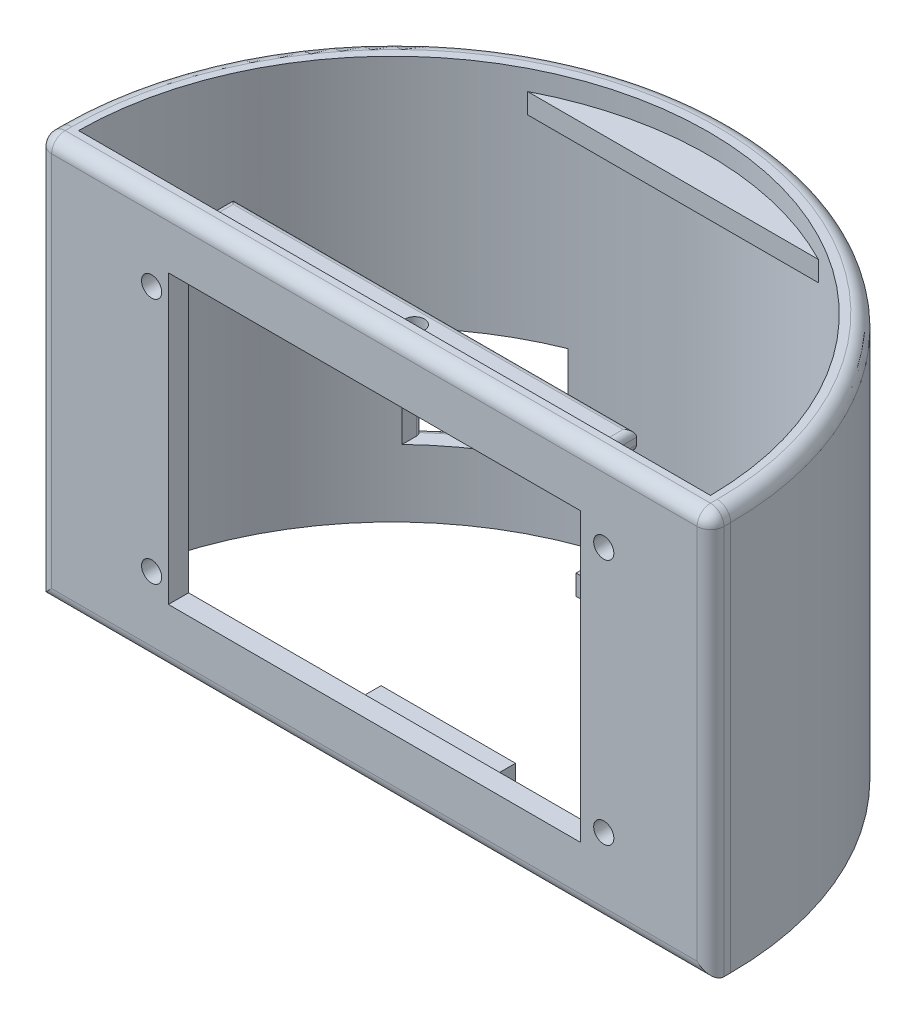
from build123d import *

# Parameters (mm, degrees)
SKETCH1_W                = 100
SKETCH1_H                = 60
SKETCH1_R                = 1.5
SKETCH1_W_2              = 61.26
SKETCH1_H_2              = 42.72
FRONT_FACE_DEPTH         = 3
CURVED_BCK_DEPTH         = 60
FILLET1_R                = 2
FRONT_START              = 57
SKETCH3_W                = 60
SKETCH3_H                = 6
SKETCH3_R                = 1.45
FRONT_RETAINER_DEPTH     = 3
FILLET2_R                = 1
FILLET3_R                = 1
BOSS_EXTRUDE4_START      = 54
BOSS_EXTRUDE4_DEPTH      = 3
CUT_EXTRUDE1_START       = -10
SKETCH5_W                = 15
SKETCH5_H                = 15
CUT_EXTRUDE1_DEPTH       = 53
SKETCH6_W                = 20
SKETCH6_H                = 3
BOSS_EXTRUDE5_DEPTH      = 8
SKETCH7_R                = 1.45
CUT_EXTRUDE2_DEPTH       = 3
FILLET4_R                = 2
FILLET5_R                = 1
BOSS_EXTRUDE6_DEPTH      = 10
BOSS_EXTRUDE6_DEPTH_BACK = 1
BOSS_EXTRUDE6_START      = 30
SKETCH9_W                = 20
SKETCH9_H                = 3
SKETCH10_R               = 1.45
CUT_EXTRUDE3_DEPTH       = 10


with BuildPart() as part:
    # Sketch1 → Front Face (new body)
    with BuildSketch(Plane.XY):
        with Locations((50, 30)):
            Rectangle(SKETCH1_W, SKETCH1_H)
        with Locations((84.12, 48.36)):
            Circle(SKETCH1_R, mode=Mode.SUBTRACT)
        with Locations((16.87, 48.36)):
            Circle(SKETCH1_R, mode=Mode.SUBTRACT)
        with Locations((16.87, 11.64)):
            Circle(SKETCH1_R, mode=Mode.SUBTRACT)
        with Locations((84.12, 11.64)):
            Circle(SKETCH1_R, mode=Mode.SUBTRACT)
        with Locations((50, 30)):
            Rectangle(SKETCH1_W_2, SKETCH1_H_2, mode=Mode.SUBTRACT)
    extrude(amount=FRONT_FACE_DEPTH)

    # Sketch2 → Curved bck (add)
    with BuildSketch(Plane(origin=(0, 0, 0), x_dir=(1, 0, 0), z_dir=(0, 1, 0))):
        with BuildLine():
            Line((0, 0), (3, 0))
            ThreePointArc((3, 0), (50, 46.689559336), (97, 0))
            Line((97, 0), (100, 0))
            ThreePointArc((100, 0), (50, 50), (0, 0))
        make_face()
    extrude(amount=CURVED_BCK_DEPTH)

    # Fillet1
    fillet1_edges = [part.edges().sort_by_distance(p)[0] for p in [
        (100, 30, 3),
        (50, 60, 3),
        (0, 30, 3),
        (50, 0, 3),
    ]]
    fillet(fillet1_edges, radius=FILLET1_R)

    # Sketch4 → Boss-Extrude4 (add)
    with BuildSketch(Plane(origin=(0, 0, 0), x_dir=(1, 0, 0), z_dir=(0, 1, 0)).offset(BOSS_EXTRUDE4_START)):
        with BuildLine():
            Line((71.620680917, 41.421525868), (28.379319083, 41.421525868))
            ThreePointArc((28.379319083, 41.421525868), (50, 46.689559336), (71.620680917, 41.421525868))
        make_face()
    extrude(amount=BOSS_EXTRUDE4_DEPTH)

    # Sketch5 → Cut-Extrude1 (cut)
    with BuildSketch(Plane.XY.offset(CUT_EXTRUDE1_START)):
        with Locations((25, 17.5)):
            Rectangle(SKETCH5_W, SKETCH5_H)
    extrude(amount=-CUT_EXTRUDE1_DEPTH, mode=Mode.SUBTRACT)

    # Sketch6 → Boss-Extrude5 (add)
    with BuildSketch(Plane(origin=(0, 0, 0), x_dir=(-1, 0, 0), z_dir=(0, 0, -1))):
        with Locations((-50, 1.5)):
            Rectangle(SKETCH6_W, SKETCH6_H)
    extrude(amount=BOSS_EXTRUDE5_DEPTH)

    # Sketch7 → Cut-Extrude2 (cut)
    with BuildSketch(Plane.XZ):
        with Locations(Location((50, -4, 0), (0, 0, 270))):
            Circle(SKETCH7_R)
    extrude(amount=-CUT_EXTRUDE2_DEPTH, mode=Mode.SUBTRACT)

    # Fillet4
    # the kernel refuses this fillet: 2 mm, written as the material it takes off along each edge
    with BuildSketch(Plane(origin=(98, 58, 1), x_dir=(0, 1, 0), z_dir=(1, 0, 0))) as fillet4_piece_1_section:
        Polygon((0, 0), (FILLET4_R, 0), (FILLET4_R, FILLET4_R), (0, FILLET4_R), align=None)
    fillet4_piece_1 = extrude(amount=FILLET4_R, mode=Mode.PRIVATE)
    fillet4_piece_1 = fillet4_piece_1 - Plane(origin=(98, 58, 1), x_dir=(0, -0.7071067811865475, -0.7071067811865475), z_dir=(1, 0, 0)) * Sphere(FILLET4_R, mode=Mode.PRIVATE)
    add(fillet4_piece_1, mode=Mode.SUBTRACT)
    with BuildSketch(Plane(origin=(2, 58, 1), x_dir=(0, 1, 0), z_dir=(-1, 0, 0))) as fillet4_piece_2_section:
        Polygon((0, 0), (FILLET4_R, 0), (FILLET4_R, -FILLET4_R), (0, -FILLET4_R), align=None)
    fillet4_piece_2 = extrude(amount=FILLET4_R, mode=Mode.PRIVATE)
    fillet4_piece_2 = fillet4_piece_2 - Plane(origin=(2, 58, 1), x_dir=(0, -0.7071067811865475, -0.7071067811865475), z_dir=(-1, 0, 0)) * Sphere(FILLET4_R, mode=Mode.PRIVATE)
    add(fillet4_piece_2, mode=Mode.SUBTRACT)
    with BuildSketch(Plane(origin=(50, 60, 0), x_dir=(1, 0, 0), z_dir=(0, 0, 1))) as fillet4_piece_3:
        with BuildLine():
            CenterArc((50 - FILLET4_R, -FILLET4_R), FILLET4_R, 0, 90)
            Line((50 - FILLET4_R, 0), (50, 0))
            Line((50, 0), (50, -FILLET4_R))
        make_face()
    revolve(axis=Axis((50, 60, 0), (0, 1, 0)), revolution_arc=180, mode=Mode.SUBTRACT)
    with BuildSketch(Plane(origin=(100, 60, 0), x_dir=(0, -1, 0), z_dir=(0, 0, 1))) as fillet4_piece_4:
        with BuildLine():
            CenterArc((FILLET4_R, -FILLET4_R), FILLET4_R, 90, 90)
            Line((0, -FILLET4_R), (0, 0))
            Line((0, 0), (FILLET4_R, 0))
        make_face()
    extrude(amount=1, mode=Mode.SUBTRACT)
    with BuildSketch(Plane(origin=(0, 60, 0), x_dir=(0, -1, 0), z_dir=(0, 0, 1))) as fillet4_piece_5:
        with BuildLine():
            CenterArc((FILLET4_R, FILLET4_R), FILLET4_R, 180, 90)
            Line((0, FILLET4_R), (0, 0))
            Line((0, 0), (FILLET4_R, 0))
        make_face()
    extrude(amount=1, mode=Mode.SUBTRACT)

    # Fillet5
    # the kernel refuses this fillet: 1 mm, written as the material it takes off along each edge
    with BuildSketch(Plane(origin=(50, 25, 0), x_dir=(-0.6871692739731919, 0, -0.7264973426704026), z_dir=(-0.7264973426704026, 0, 0.6871692739731919))) as fillet5_piece_1_section:
        with BuildLine():
            CenterArc((50 - FILLET5_R, -FILLET5_R), FILLET5_R, 0, 90)
            Line((50 - FILLET5_R, 0), (50, 0))
            Line((50, 0), (50, -FILLET5_R))
        make_face()
    fillet5_piece_1 = revolve(axis=Axis((50, 25, 0), (0, -1, 0)), revolution_arc=25.783978958, mode=Mode.PRIVATE)
    fillet5_piece_1 = split(fillet5_piece_1, bisect_by=Plane(origin=(17.5, 25.281244753, -42.609088652), z_dir=(1, 0, 0)), keep=Keep.TOP, mode=Mode.PRIVATE)
    fillet5_piece_1 = split(fillet5_piece_1, bisect_by=Plane(origin=(32.5, 25.281244753, -42.609088652), z_dir=(-1, 0, 0)), keep=Keep.TOP, mode=Mode.PRIVATE)
    add(fillet5_piece_1, mode=Mode.SUBTRACT)
    with BuildSketch(Plane(origin=(17.5, 25, -37.996710384), x_dir=(-0.7450513884605198, 0, 0.6670070678434014), z_dir=(0, -1, 0))) as fillet5_piece_2:
        with BuildLine():
            CenterArc((2.237210427, -0.999744631), FILLET5_R, 88.705114871, 133.131372131)
            Line((1.492159038, -1.666751699), (0, 0))
            ThreePointArc((0, 0), (1.129904256, 0.012768467), (2.259808512, 0))
        make_face()
    extrude(amount=15, mode=Mode.SUBTRACT)
    with BuildSketch(Plane(origin=(50, 10, 0), x_dir=(-0.6871692739731919, 0, -0.7264973426704026), z_dir=(-0.7264973426704026, 0, 0.6871692739731919))) as fillet5_piece_3_section:
        with BuildLine():
            CenterArc((50 - FILLET5_R, FILLET5_R), FILLET5_R, 270, 90)
            Line((50 - FILLET5_R, 0), (50, 0))
            Line((50, 0), (50, FILLET5_R))
        make_face()
    fillet5_piece_3 = revolve(axis=Axis((50, 10, 0), (0, -1, 0)), revolution_arc=25.783978958, mode=Mode.PRIVATE)
    fillet5_piece_3 = split(fillet5_piece_3, bisect_by=Plane(origin=(17.5, 9.718755246, -42.609088652), z_dir=(1, 0, 0)), keep=Keep.TOP, mode=Mode.PRIVATE)
    fillet5_piece_3 = split(fillet5_piece_3, bisect_by=Plane(origin=(32.5, 9.718755246, -42.609088652), z_dir=(-1, 0, 0)), keep=Keep.TOP, mode=Mode.PRIVATE)
    add(fillet5_piece_3, mode=Mode.SUBTRACT)
    with BuildSketch(Plane(origin=(32.5, 25, -46.837484988), x_dir=(0.9391980540607006, 0, -0.34337590953442465), z_dir=(0, -1, 0))) as fillet5_piece_4:
        with BuildLine():
            CenterArc((0.699141837, 0.999975063), FILLET5_R, 200.082686736, 70.321941643)
            Line((-0.240056217, 0.656599154), (0, 0))
            ThreePointArc((0, 0), (0.353101938, -0.001246825), (0.706203876, 0))
        make_face()
    extrude(amount=15, mode=Mode.SUBTRACT)
    with BuildSketch(Plane(origin=(17.5, 30.64952128, -37.996710384), x_dir=(-0.7450513884605213, 0, 0.6670070678433995), z_dir=(0, -1, 0))) as fillet5_piece_5a_section:
        with BuildLine():
            CenterArc((2.237210427, -0.999744631), FILLET5_R, 88.705114871, 133.131372131)
            Line((1.492159038, -1.666751699), (0, 0))
            ThreePointArc((0, 0), (1.129904256, 0.012768467), (2.259808512, 0))
        make_face()
    fillet5_piece_5a = extrude(amount=20.64952128, mode=Mode.PRIVATE)
    fillet5_piece_5a = split(fillet5_piece_5a, bisect_by=Plane(origin=(17.065734443, 25, -37.044794367), z_dir=(0, 1, 0)), keep=Keep.TOP, mode=Mode.PRIVATE)
    with BuildSketch(Plane(origin=(50, 25, 0), x_dir=(-0.6871692739731919, 0, -0.7264973426704026), z_dir=(-0.7264973426704026, 0, 0.6871692739731919))) as fillet5_piece_5b_section:
        with BuildLine():
            CenterArc((50 - FILLET5_R, -FILLET5_R), FILLET5_R, 0, 90)
            Line((50 - FILLET5_R, 0), (50, 0))
            Line((50, 0), (50, -FILLET5_R))
        make_face()
    fillet5_piece_5b = revolve(axis=Axis((50, 25, 0), (0, -1, 0)), revolution_arc=25.783978958, mode=Mode.PRIVATE)
    fillet5_piece_5b = split(fillet5_piece_5b, bisect_by=Plane(origin=(17.5, 25.237274153, -36.954673212), z_dir=(-1, 0, 0)), keep=Keep.TOP, mode=Mode.PRIVATE)
    fillet5_piece_5 = fillet5_piece_5a & fillet5_piece_5b
    add(fillet5_piece_5, mode=Mode.SUBTRACT)
    with BuildSketch(Plane(origin=(50, 25, 0), x_dir=(-0.6871692739731919, 0, -0.7264973426704026), z_dir=(-0.7264973426704026, 0, 0.6871692739731919))) as fillet5_piece_6a_section:
        with BuildLine():
            CenterArc((50 - FILLET5_R, -FILLET5_R), FILLET5_R, 0, 90)
            Line((50 - FILLET5_R, 0), (50, 0))
            Line((50, 0), (50, -FILLET5_R))
        make_face()
    fillet5_piece_6a = revolve(axis=Axis((50, 25, 0), (0, -1, 0)), revolution_arc=25.783978958, mode=Mode.PRIVATE)
    fillet5_piece_6a = split(fillet5_piece_6a, bisect_by=Plane(origin=(32.5, 25.222938774, -47.02133106), z_dir=(1, 0, 0)), keep=Keep.TOP, mode=Mode.PRIVATE)
    with BuildSketch(Plane(origin=(32.5, 26.76550969, -46.837484988), x_dir=(0.9391980540607002, 0, -0.3433759095344255), z_dir=(0, -1, 0))) as fillet5_piece_6b_section:
        with BuildLine():
            CenterArc((0.699141837, 0.999975063), FILLET5_R, 200.082686736, 70.321941643)
            Line((-0.240056217, 0.656599154), (0, 0))
            ThreePointArc((0, 0), (0.353101938, -0.001246825), (0.706203876, 0))
        make_face()
    fillet5_piece_6b = extrude(amount=16.76550969, mode=Mode.PRIVATE)
    fillet5_piece_6b = split(fillet5_piece_6b, bisect_by=Plane(origin=(32.645581665, 25, -46.738365557), z_dir=(0, 1, 0)), keep=Keep.TOP, mode=Mode.PRIVATE)
    fillet5_piece_6 = fillet5_piece_6a & fillet5_piece_6b
    add(fillet5_piece_6, mode=Mode.SUBTRACT)
    with BuildSketch(Plane(origin=(17.5, 25, -37.996710384), x_dir=(-0.7450513884605198, 0, 0.6670070678434014), z_dir=(0, -1, 0))) as fillet5_piece_7a_section:
        with BuildLine():
            CenterArc((2.237210427, -0.999744631), FILLET5_R, 88.705114871, 133.131372131)
            Line((1.492159038, -1.666751699), (0, 0))
            ThreePointArc((0, 0), (1.129904256, 0.012768467), (2.259808512, 0))
        make_face()
    fillet5_piece_7a = extrude(amount=20.64952128, mode=Mode.PRIVATE)
    fillet5_piece_7a = split(fillet5_piece_7a, bisect_by=Plane(origin=(17.065734443, 10, -37.044794367), z_dir=(0, -1, 0)), keep=Keep.TOP, mode=Mode.PRIVATE)
    with BuildSketch(Plane(origin=(50, 10, 0), x_dir=(-0.6871692739731919, 0, -0.7264973426704026), z_dir=(-0.7264973426704026, 0, 0.6871692739731919))) as fillet5_piece_7b_section:
        with BuildLine():
            CenterArc((50 - FILLET5_R, FILLET5_R), FILLET5_R, 270, 90)
            Line((50 - FILLET5_R, 0), (50, 0))
            Line((50, 0), (50, FILLET5_R))
        make_face()
    fillet5_piece_7b = revolve(axis=Axis((50, 10, 0), (0, -1, 0)), revolution_arc=25.783978958, mode=Mode.PRIVATE)
    fillet5_piece_7b = split(fillet5_piece_7b, bisect_by=Plane(origin=(17.5, 9.762725864, -36.954673145), z_dir=(-1, 0, 0)), keep=Keep.TOP, mode=Mode.PRIVATE)
    fillet5_piece_7 = fillet5_piece_7a & fillet5_piece_7b
    add(fillet5_piece_7, mode=Mode.SUBTRACT)
    with BuildSketch(Plane(origin=(50, 10, 0), x_dir=(-0.6871692739731919, 0, -0.7264973426704026), z_dir=(-0.7264973426704026, 0, 0.6871692739731919))) as fillet5_piece_8a_section:
        with BuildLine():
            CenterArc((50 - FILLET5_R, FILLET5_R), FILLET5_R, 270, 90)
            Line((50 - FILLET5_R, 0), (50, 0))
            Line((50, 0), (50, FILLET5_R))
        make_face()
    fillet5_piece_8a = revolve(axis=Axis((50, 10, 0), (0, -1, 0)), revolution_arc=25.783978958, mode=Mode.PRIVATE)
    fillet5_piece_8a = split(fillet5_piece_8a, bisect_by=Plane(origin=(32.5, 9.777061235, -47.021331079), z_dir=(1, 0, 0)), keep=Keep.TOP, mode=Mode.PRIVATE)
    with BuildSketch(Plane(origin=(32.5, 25, -46.837484988), x_dir=(0.9391980540607006, 0, -0.34337590953442465), z_dir=(0, -1, 0))) as fillet5_piece_8b_section:
        with BuildLine():
            CenterArc((0.699141837, 0.999975063), FILLET5_R, 200.082686736, 70.321941643)
            Line((-0.240056217, 0.656599154), (0, 0))
            ThreePointArc((0, 0), (0.353101938, -0.001246825), (0.706203876, 0))
        make_face()
    fillet5_piece_8b = extrude(amount=16.76550969, mode=Mode.PRIVATE)
    fillet5_piece_8b = split(fillet5_piece_8b, bisect_by=Plane(origin=(32.645581665, 10, -46.738365557), z_dir=(0, -1, 0)), keep=Keep.TOP, mode=Mode.PRIVATE)
    fillet5_piece_8 = fillet5_piece_8a & fillet5_piece_8b
    add(fillet5_piece_8, mode=Mode.SUBTRACT)

    # Sketch9 → Boss-Extrude6 (add, two sides: drawn at the far end of the back side and taken through both)
    with BuildSketch(Plane(origin=(0, 0, -8), x_dir=(-1, 0, 0), z_dir=(0, 0, -1)).offset(BOSS_EXTRUDE6_START - BOSS_EXTRUDE6_DEPTH_BACK)):
        with Locations((-50, 1.5)):
            Rectangle(SKETCH9_W, SKETCH9_H)
    extrude(amount=BOSS_EXTRUDE6_DEPTH + BOSS_EXTRUDE6_DEPTH_BACK)

    # Sketch10 → Cut-Extrude3 (cut)
    with BuildSketch(Plane(origin=(0, 3, 0), x_dir=(1, 0, 0), z_dir=(0, 1, 0))):
        with Locations(Location((50, 42, 0), (0, 0, 270))):
            Circle(SKETCH10_R)
    extrude(amount=-CUT_EXTRUDE3_DEPTH, mode=Mode.SUBTRACT)


with BuildPart() as body_2:
    # Sketch3 → Front retainer (new body)
    with BuildSketch(Plane(origin=(0, 0, 0), x_dir=(1, 0, 0), z_dir=(0, 1, 0)).offset(FRONT_START)):
        with Locations((50, 3)):
            Rectangle(SKETCH3_W, SKETCH3_H)
        with Locations(Location((50, 3, 0), (0, 0, 270))):
            Circle(SKETCH3_R, mode=Mode.SUBTRACT)
    extrude(amount=-FRONT_RETAINER_DEPTH)

    # Fillet2
    fillet2_edges = [body_2.edges().sort_by_distance(p)[0] for p in [
        (80, 54, -3),
        (50, 54, -6),
        (20, 54, -3),
    ]]
    fillet(fillet2_edges, radius=FILLET2_R)

    # Fillet3
    fillet3_edges = [body_2.edges().sort_by_distance(p)[0] for p in [
        (50, 57, -6),
        (80, 57, -3),
        (20, 57, -3),
    ]]
    fillet(fillet3_edges, radius=FILLET3_R)


solid = Compound([part.part, body_2.part])
